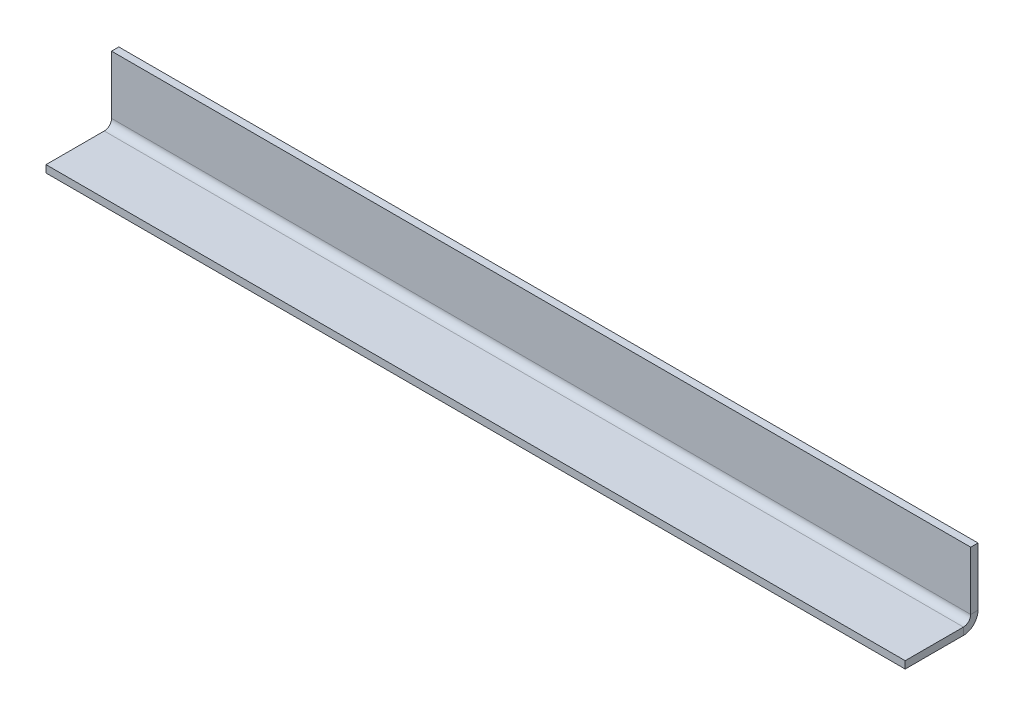
from build123d import *

# Parameters (mm, degrees)
BASE_FLANGE1_DEPTH = 374.65


# Sheet-metal steps are written as plain solids
with BuildPart() as part:
    # Sketch1 → Base-Flange1 (new body)
    with BuildSketch(Plane(origin=(0, 0, 0), x_dir=(0, 0, -1), z_dir=(1, 0, 0))):
        with BuildLine():
            Line((0, 0), (25.4, 0))
            ThreePointArc((25.4, 0), (29.890128061, 1.859871939), (31.75, 6.35))
            Line((31.75, 6.35), (31.75, 31.75))
            Line((31.75, 31.75), (28.575, 31.75))
            Line((28.575, 31.75), (28.575, 6.35))
            ThreePointArc((28.575, 6.35), (27.64506403, 4.10493597), (25.4, 3.175))
            Line((25.4, 3.175), (0, 3.175))
            Line((0, 3.175), (0, 0))
        make_face()
    extrude(amount=BASE_FLANGE1_DEPTH)


solid = part.part
